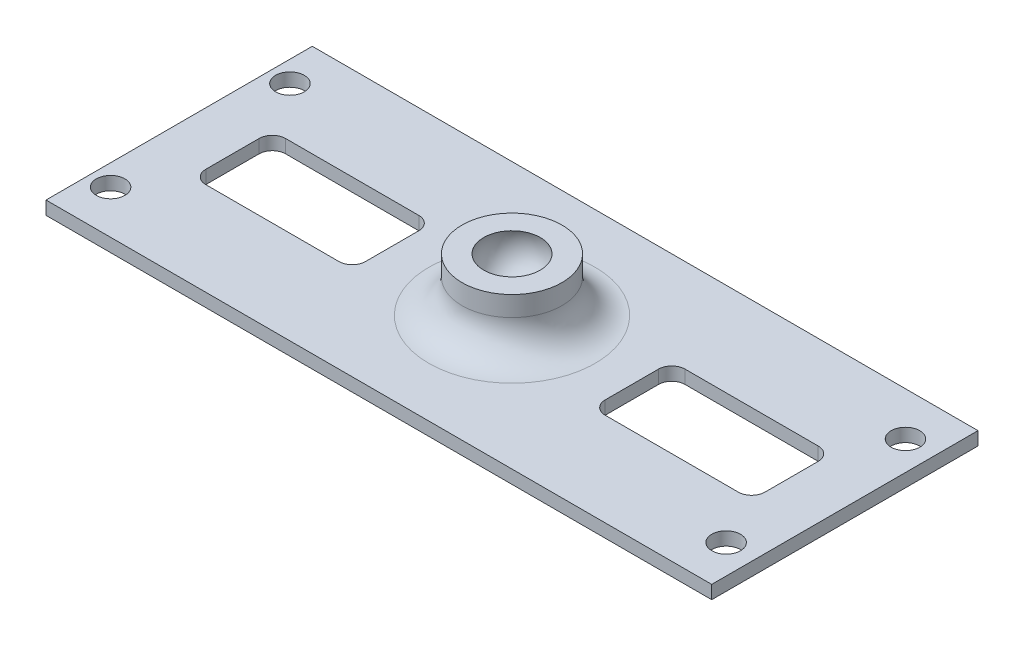
from build123d import *

# Parameters (mm, degrees)
SKETCH1_W               = 100
SKETCH1_H               = 40
BOSS_EXTRUDE1_DEPTH     = 2
F_6_CLEARANCE_HOLE1_D   = 4.3053
ESQUISSE1_R             = 7.5
BOSS_EXTRU_2_DEPTH      = 8
CONG_1_R                = 5
ENL_V_MAT_EXTRU_1_DEPTH = 8


with BuildPart() as part:
    # Sketch1 → Boss-Extrude1 (new body)
    with BuildSketch(Plane(origin=(0, 0, 0), x_dir=(1, 0, 0), z_dir=(0, 1, 0))):
        Rectangle(SKETCH1_W, SKETCH1_H)
    extrude(amount=BOSS_EXTRUDE1_DEPTH)

    # #6 Clearance Hole1 (through all)
    with Locations(Plane(origin=(0, 2, 0), x_dir=(1, 0, 0), z_dir=(0, 1, 0))):
        with Locations((45.6352, 13.470384182), (45.6352, -13.470384182), (-46.825, -13.470384182), (-46.825, 13.470384182)):
            Hole(F_6_CLEARANCE_HOLE1_D / 2)

    # Esquisse1 → Boss.-Extru.2 (add)
    with BuildSketch(Plane(origin=(0, 2, 0), x_dir=(1, 0, 0), z_dir=(0, 1, 0))):
        Circle(ESQUISSE1_R)
    extrude(amount=BOSS_EXTRU_2_DEPTH)

    # Esquisse3 → Enlèvement de matière-Révolution1 (revolve, cut)
    with BuildSketch(Plane.XY):
        with BuildLine():
            Line((0, 3.7), (0, 12.867063492))
            ThreePointArc((0, 12.867063492), (-4.583531746, 8.283531746), (0, 3.7))
        make_face()
    revolve(axis=Axis((0, 0, 0), (0, 1, 0)), mode=Mode.SUBTRACT)

    # Congé1
    cong_1_edges = [part.edges().sort_by_distance(p)[0] for p in [
        (-7.5, 2, 0),
    ]]
    fillet(cong_1_edges, radius=CONG_1_R)

    # Esquisse5 → Enlèv. mat.-Extru.1 (cut)
    with BuildSketch(Plane(origin=(0, 2, 0), x_dir=(1, 0, 0), z_dir=(0, 1, 0))):
        with BuildLine():
            Line((-40, -6), (-20, -6))
            ThreePointArc((-20, -6), (-18.585786438, -5.414213562), (-18, -4))
            Line((-18, -4), (-18, 4))
            ThreePointArc((-18, 4), (-18.585786438, 5.414213562), (-20, 6))
            Line((-20, 6), (-40, 6))
            ThreePointArc((-40, 6), (-41.414213562, 5.414213562), (-42, 4))
            Line((-42, 4), (-42, -4))
            ThreePointArc((-42, -4), (-41.414213562, -5.414213562), (-40, -6))
        make_face()
    enl_v_mat_extru_1 = extrude(amount=-ENL_V_MAT_EXTRU_1_DEPTH, mode=Mode.SUBTRACT)

    # Symétrie1: Enlèv. mat.-Extru.1 across plane
    add(enl_v_mat_extru_1.mirror(Plane(origin=(0, 0, 0), x_dir=(0, 0, 1), z_dir=(1, 0, 0))), mode=Mode.SUBTRACT)


solid = part.part
